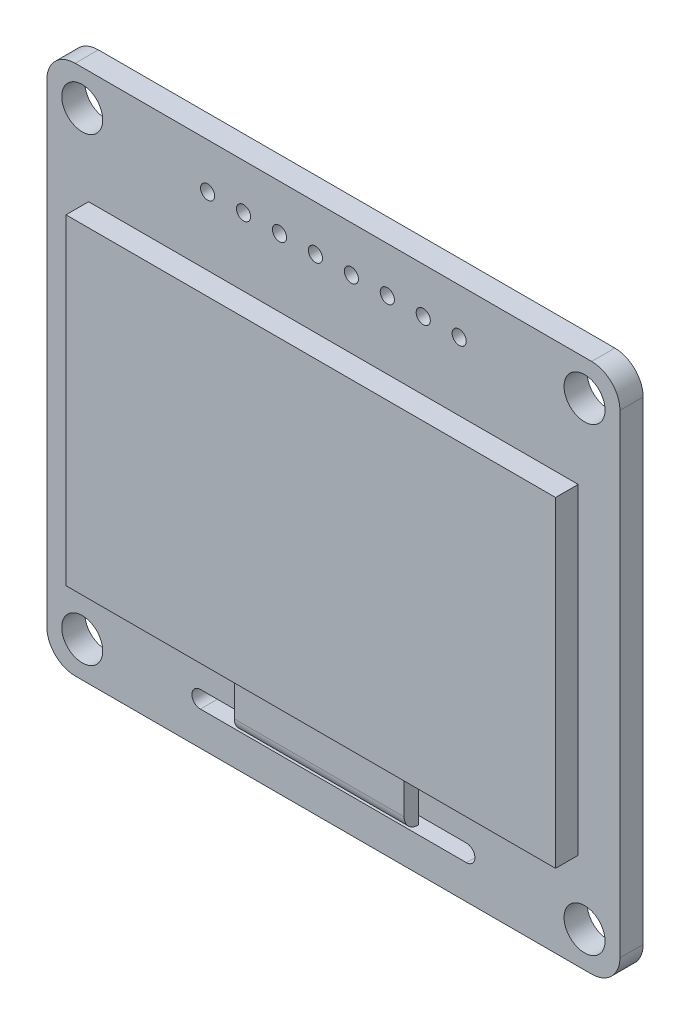
from build123d import *

# Parameters (mm, degrees)
SKETCH1_W           = 40.5
SKETCH1_H           = 37.5
PCB_DEPTH           = 1.64
FILLET1_R           = 2
MOUNT_HOLE_REACH    = 29.646
SKETCH2_R           = 1.45
SLOT_REACH          = 29.646
CUT_EXTRUDE3_REACH  = 29.646
SKETCH4_R           = 0.5
SKETCH5_W           = 34.6
SKETCH5_H           = 22.7
OLED_GLASS_DEPTH    = 1.6
SKETCH6_W           = 12
SKETCH6_H           = 3.8
BOSS_EXTRUDE3_DEPTH = 1
FILLET2_R           = 1


with BuildPart() as part:
    # Sketch1 → PCB (new body)
    with BuildSketch(Plane.XY):
        Rectangle(SKETCH1_W, SKETCH1_H)
    extrude(amount=PCB_DEPTH)

    # Fillet1
    fillet1_edges = [part.edges().sort_by_distance(p)[0] for p in [
        (-20.25, 18.75, 0.82),
        (20.25, 18.75, 0.82),
        (20.25, -18.75, 0.82),
        (-20.25, -18.75, 0.82),
    ]]
    fillet(fillet1_edges, radius=FILLET1_R)

    # Sketch2 → mount hole (cut, up to next)
    with BuildSketch(Plane.XY.offset(1.64), mode=Mode.PRIVATE) as mount_hole_sk1:
        with Locations((-17.75, 16.25)):
            Circle(SKETCH2_R)
    mount_hole_tool1 = extrude(mount_hole_sk1.sketch, amount=-MOUNT_HOLE_REACH, mode=Mode.PRIVATE) & part.part
    # Sketch2 → mount hole (cut, up to next)
    with BuildSketch(Plane.XY.offset(1.64), mode=Mode.PRIVATE) as mount_hole_sk2:
        with Locations((17.75, 16.25)):
            Circle(SKETCH2_R)
    mount_hole_tool2 = extrude(mount_hole_sk2.sketch, amount=-MOUNT_HOLE_REACH, mode=Mode.PRIVATE) & part.part
    # Sketch2 → mount hole (cut, up to next)
    with BuildSketch(Plane.XY.offset(1.64), mode=Mode.PRIVATE) as mount_hole_sk3:
        with Locations((17.75, -16.25)):
            Circle(SKETCH2_R)
    mount_hole_tool3 = extrude(mount_hole_sk3.sketch, amount=-MOUNT_HOLE_REACH, mode=Mode.PRIVATE) & part.part
    # Sketch2 → mount hole (cut, up to next)
    with BuildSketch(Plane.XY.offset(1.64), mode=Mode.PRIVATE) as mount_hole_sk4:
        with Locations((-17.75, -16.25)):
            Circle(SKETCH2_R)
    mount_hole_tool4 = extrude(mount_hole_sk4.sketch, amount=-MOUNT_HOLE_REACH, mode=Mode.PRIVATE) & part.part
    add(mount_hole_tool1.solids().sort_by_distance((-17.75, 16.25, 1.64))[0], mode=Mode.SUBTRACT)
    add(mount_hole_tool2.solids().sort_by_distance((17.75, 16.25, 1.64))[0], mode=Mode.SUBTRACT)
    add(mount_hole_tool3.solids().sort_by_distance((17.75, -16.25, 1.64))[0], mode=Mode.SUBTRACT)
    add(mount_hole_tool4.solids().sort_by_distance((-17.75, -16.25, 1.64))[0], mode=Mode.SUBTRACT)

    # Sketch3 → slot (cut, up to next)
    with BuildSketch(Plane.XY.offset(1.64), mode=Mode.PRIVATE) as slot_sk1:
        with BuildLine():
            Line((-9.4, -15.15), (9.4, -15.15))
            ThreePointArc((9.4, -15.15), (10, -15.75), (9.4, -16.35))
            Line((9.4, -16.35), (-9.4, -16.35))
            ThreePointArc((-9.4, -16.35), (-10, -15.75), (-9.4, -15.15))
        make_face()
    slot_tool1 = extrude(slot_sk1.sketch, amount=-SLOT_REACH, mode=Mode.PRIVATE) & part.part
    add(slot_tool1.solids().sort_by_distance((0, -15.75, 1.64))[0], mode=Mode.SUBTRACT)

    # Sketch4 → Cut-Extrude3 (cut, up to next)
    with BuildSketch(Plane.XY.offset(1.64), mode=Mode.PRIVATE) as cut_extrude3_sk1:
        with Locations((-8.89, 15.55)):
            Circle(SKETCH4_R)
    cut_extrude3_tool1 = extrude(cut_extrude3_sk1.sketch, amount=-CUT_EXTRUDE3_REACH, mode=Mode.PRIVATE) & part.part
    # Sketch4 → Cut-Extrude3 (cut, up to next)
    with BuildSketch(Plane.XY.offset(1.64), mode=Mode.PRIVATE) as cut_extrude3_sk2:
        with Locations((-6.35, 15.55)):
            Circle(SKETCH4_R)
    cut_extrude3_tool2 = extrude(cut_extrude3_sk2.sketch, amount=-CUT_EXTRUDE3_REACH, mode=Mode.PRIVATE) & part.part
    # Sketch4 → Cut-Extrude3 (cut, up to next)
    with BuildSketch(Plane.XY.offset(1.64), mode=Mode.PRIVATE) as cut_extrude3_sk3:
        with Locations((-3.81, 15.55)):
            Circle(SKETCH4_R)
    cut_extrude3_tool3 = extrude(cut_extrude3_sk3.sketch, amount=-CUT_EXTRUDE3_REACH, mode=Mode.PRIVATE) & part.part
    # Sketch4 → Cut-Extrude3 (cut, up to next)
    with BuildSketch(Plane.XY.offset(1.64), mode=Mode.PRIVATE) as cut_extrude3_sk4:
        with Locations((-1.27, 15.55)):
            Circle(SKETCH4_R)
    cut_extrude3_tool4 = extrude(cut_extrude3_sk4.sketch, amount=-CUT_EXTRUDE3_REACH, mode=Mode.PRIVATE) & part.part
    # Sketch4 → Cut-Extrude3 (cut, up to next)
    with BuildSketch(Plane.XY.offset(1.64), mode=Mode.PRIVATE) as cut_extrude3_sk5:
        with Locations((1.27, 15.55)):
            Circle(SKETCH4_R)
    cut_extrude3_tool5 = extrude(cut_extrude3_sk5.sketch, amount=-CUT_EXTRUDE3_REACH, mode=Mode.PRIVATE) & part.part
    # Sketch4 → Cut-Extrude3 (cut, up to next)
    with BuildSketch(Plane.XY.offset(1.64), mode=Mode.PRIVATE) as cut_extrude3_sk6:
        with Locations((3.81, 15.55)):
            Circle(SKETCH4_R)
    cut_extrude3_tool6 = extrude(cut_extrude3_sk6.sketch, amount=-CUT_EXTRUDE3_REACH, mode=Mode.PRIVATE) & part.part
    # Sketch4 → Cut-Extrude3 (cut, up to next)
    with BuildSketch(Plane.XY.offset(1.64), mode=Mode.PRIVATE) as cut_extrude3_sk7:
        with Locations((6.35, 15.55)):
            Circle(SKETCH4_R)
    cut_extrude3_tool7 = extrude(cut_extrude3_sk7.sketch, amount=-CUT_EXTRUDE3_REACH, mode=Mode.PRIVATE) & part.part
    # Sketch4 → Cut-Extrude3 (cut, up to next)
    with BuildSketch(Plane.XY.offset(1.64), mode=Mode.PRIVATE) as cut_extrude3_sk8:
        with Locations((8.89, 15.55)):
            Circle(SKETCH4_R)
    cut_extrude3_tool8 = extrude(cut_extrude3_sk8.sketch, amount=-CUT_EXTRUDE3_REACH, mode=Mode.PRIVATE) & part.part
    add(cut_extrude3_tool1.solids().sort_by_distance((-8.89, 15.55, 1.64))[0], mode=Mode.SUBTRACT)
    add(cut_extrude3_tool2.solids().sort_by_distance((-6.35, 15.55, 1.64))[0], mode=Mode.SUBTRACT)
    add(cut_extrude3_tool3.solids().sort_by_distance((-3.81, 15.55, 1.64))[0], mode=Mode.SUBTRACT)
    add(cut_extrude3_tool4.solids().sort_by_distance((-1.27, 15.55, 1.64))[0], mode=Mode.SUBTRACT)
    add(cut_extrude3_tool5.solids().sort_by_distance((1.27, 15.55, 1.64))[0], mode=Mode.SUBTRACT)
    add(cut_extrude3_tool6.solids().sort_by_distance((3.81, 15.55, 1.64))[0], mode=Mode.SUBTRACT)
    add(cut_extrude3_tool7.solids().sort_by_distance((6.35, 15.55, 1.64))[0], mode=Mode.SUBTRACT)
    add(cut_extrude3_tool8.solids().sort_by_distance((8.89, 15.55, 1.64))[0], mode=Mode.SUBTRACT)

    # Sketch5 → OLED glass (add)
    with BuildSketch(Plane.XY.offset(1.64)):
        with Locations((0, -0.6)):
            Rectangle(SKETCH5_W, SKETCH5_H)
    extrude(amount=OLED_GLASS_DEPTH)

    # Sketch6 → Boss-Extrude3 (add)
    with BuildSketch(Plane.XY.offset(1.64)):
        with Locations((0, -13.85)):
            Rectangle(SKETCH6_W, SKETCH6_H)
    extrude(amount=BOSS_EXTRUDE3_DEPTH)

    # Fillet2
    fillet2_edges = [part.edges().sort_by_distance(p)[0] for p in [
        (0, -15.75, 2.64),
    ]]
    fillet(fillet2_edges, radius=FILLET2_R - 0.0001)  # a hair under: the kernel refuses the full size


solid = part.part
